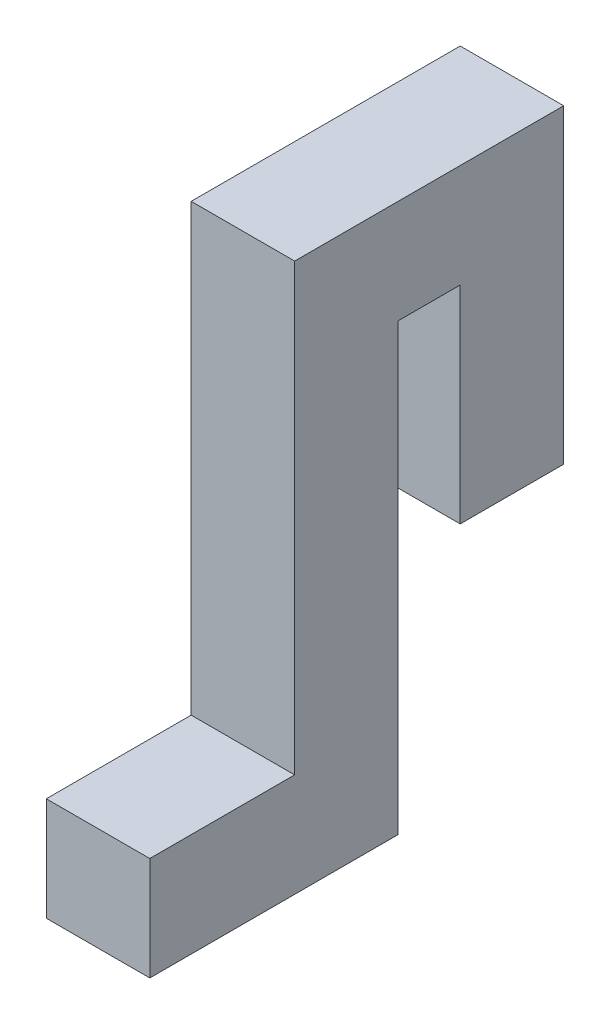
from build123d import *

# Parameters (mm, degrees)
BOSS_EXTRUDE1_DEPTH = 63.5


with BuildPart() as part:
    # Sketch1 → Boss-Extrude1 (new, symmetric)
    with BuildSketch(Plane(origin=(0, 0, 0), x_dir=(0, 0, -1), z_dir=(1, 0, 0))):
        Polygon((-241.3, -273.05), (-63.5, -273.05), (-63.5, 273.05), (63.5, 273.05), (266.7, 273.05), (266.7, 146.05), (266.7, -107.95), (139.7, -107.95), (139.7, 146.05), (63.5, 146.05), (63.5, -273.05), (63.5, -400.05), (-241.3, -400.05), align=None)
    extrude(amount=BOSS_EXTRUDE1_DEPTH, both=True)


solid = part.part
